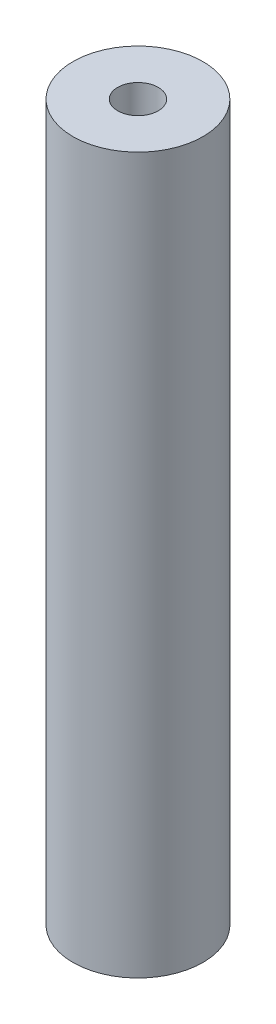
from build123d import *

# Parameters (mm, degrees)
SKETCH1_R               = 4
BOSS_EXTRUDE1_DEPTH     = 44
TAP_DRILL_FOR_M3_TAP1_D = 2.5


with BuildPart() as part:
    # Sketch1 → Boss-Extrude1 (new body)
    with BuildSketch(Plane(origin=(0, 0, 0), x_dir=(1, 0, 0), z_dir=(0, 1, 0))):
        Circle(SKETCH1_R)
    extrude(amount=BOSS_EXTRUDE1_DEPTH)

    # Tap Drill for M3 Tap1 (through all)
    with Locations(Plane(origin=(0, 44, 0), x_dir=(1, 0, 0), z_dir=(0, 1, 0))):
        with Locations((0, 0)):
            Hole(TAP_DRILL_FOR_M3_TAP1_D / 2)


solid = part.part
